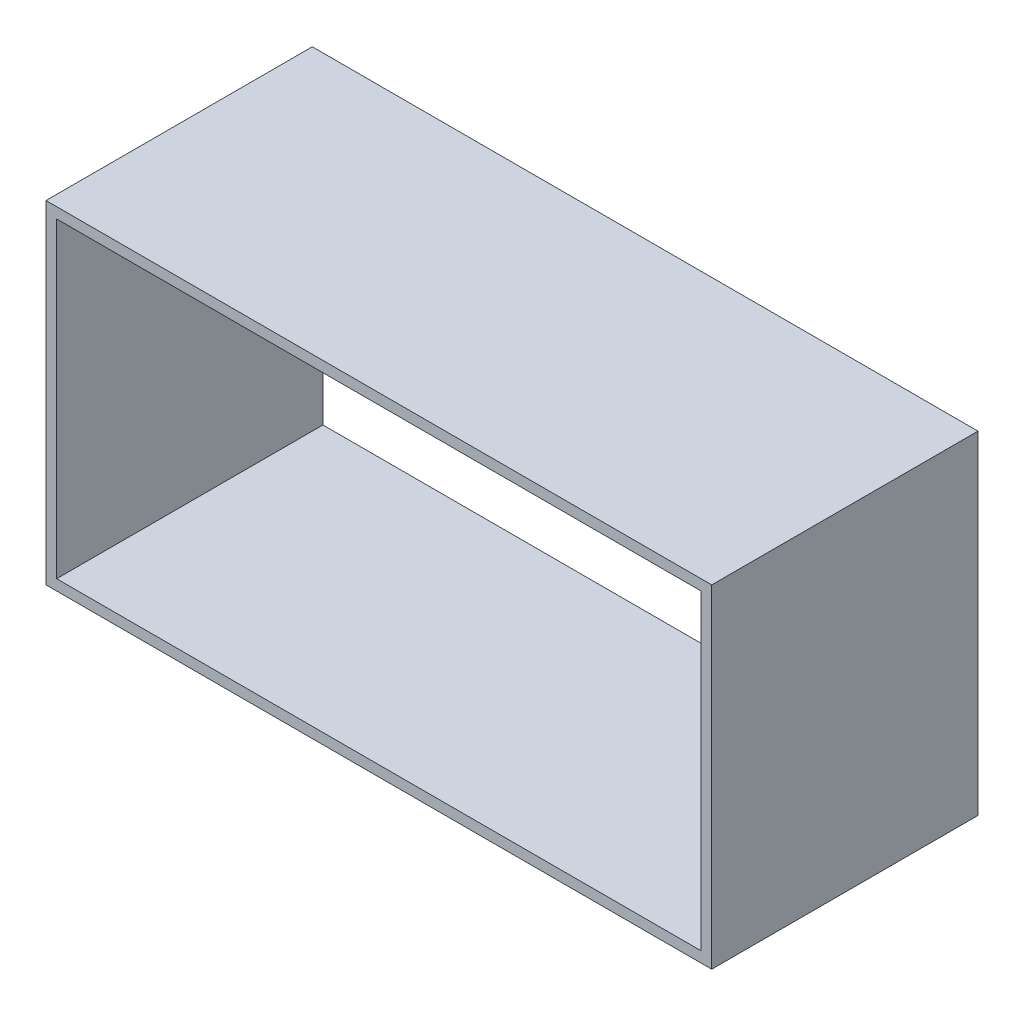
from build123d import *

# Parameters (mm, degrees)
SKIZZE1_W                       = 250
SKIZZE1_H                       = 125
SKIZZE1_W_2                     = 242
SKIZZE1_H_2                     = 117
AUFSATZ_LINEAR_AUSTRAGEN1_DEPTH = 100


with BuildPart() as part:
    # Skizze1 → Aufsatz-Linear austragen1 (new body)
    with BuildSketch(Plane.XY):
        with Locations((125, 62.5)):
            Rectangle(SKIZZE1_W, SKIZZE1_H)
        with Locations((125, 62.5)):
            Rectangle(SKIZZE1_W_2, SKIZZE1_H_2, mode=Mode.SUBTRACT)
    extrude(amount=AUFSATZ_LINEAR_AUSTRAGEN1_DEPTH)


solid = part.part
